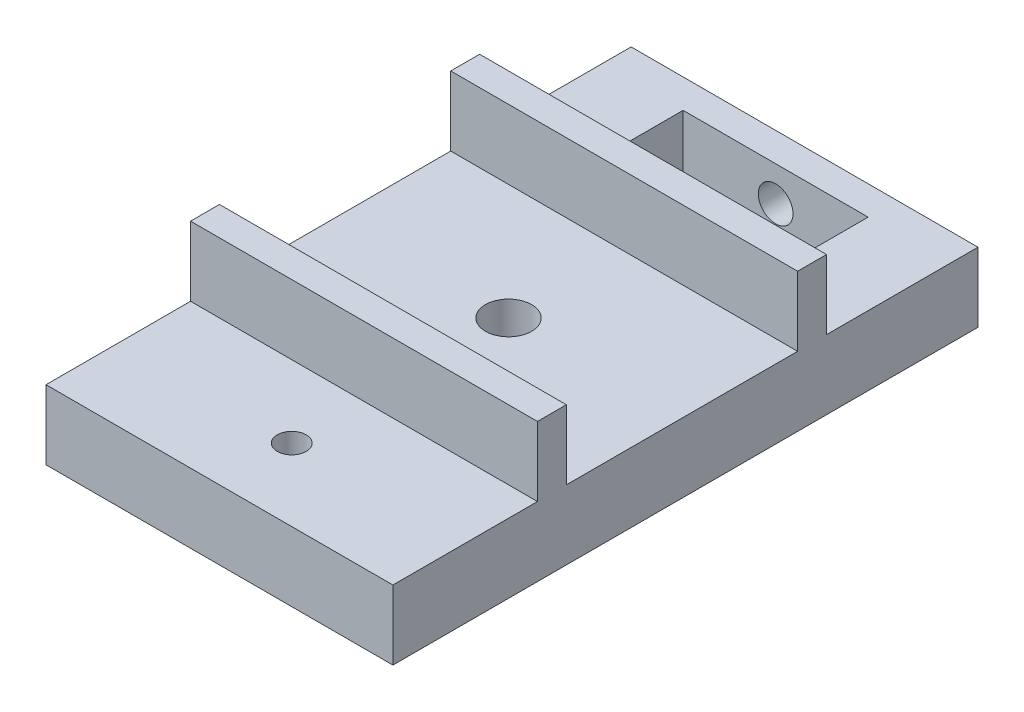
from build123d import *

# Parameters (mm, degrees)
SKETCH1_W           = 30
SKETCH1_H           = 38.1
SKETCH1_W_2         = 16
SKETCH1_H_2         = 10.6
BOSS_EXTRUDE1_DEPTH = 6
SKETCH1_3_W         = 30
SKETCH1_3_H         = 2.5
BOSS_EXTRUDE2_DEPTH = 12
SKETCH3_R           = 1.5
CUT_EXTRUDE2_DEPTH  = 5
CUT_EXTRUDE3_DEPTH  = 2.5
SKETCH2_R           = 2
CUT_EXTRUDE1_DEPTH  = 38.976966704
SKETCH5_W           = 30
SKETCH5_H           = 12.5
SKETCH5_R           = 1.25
BOSS_EXTRUDE3_DEPTH = 6


with BuildPart() as part:
    # Sketch1 → Boss-Extrude1 (new body)
    with BuildSketch(Plane(origin=(0, 0, 0), x_dir=(1, 0, 0), z_dir=(0, 1, 0))):
        with Locations((-15, -3.45)):
            Rectangle(SKETCH1_W, SKETCH1_H)
        with Locations((-15, 7.8)):
            Rectangle(SKETCH1_W_2, SKETCH1_H_2, mode=Mode.SUBTRACT)
    extrude(amount=BOSS_EXTRUDE1_DEPTH)

    # Sketch1<3> → Boss-Extrude2 (add)
    with BuildSketch(Plane(origin=(0, 0, 0), x_dir=(1, 0, 0), z_dir=(0, 1, 0))):
        with Locations((-15, -21.25)):
            Rectangle(SKETCH1_3_W, SKETCH1_3_H)
        with Locations((-15, 1.25)):
            Rectangle(SKETCH1_3_W, SKETCH1_3_H)
    extrude(amount=BOSS_EXTRUDE2_DEPTH)

    # Sketch3 → Cut-Extrude2 (cut)
    with BuildSketch(Plane(origin=(0, 0, -15.6), x_dir=(-1, 0, 0), z_dir=(0, 0, -1))):
        with Locations((15, 3)):
            Circle(SKETCH3_R)
    extrude(amount=-CUT_EXTRUDE2_DEPTH, mode=Mode.SUBTRACT)

    # Sketch4 → Cut-Extrude3 (cut)
    with BuildSketch(Plane(origin=(0, 0, -2.5), x_dir=(-1, 0, 0), z_dir=(0, 0, -1))):
        Polygon((16.443375673, 0.5), (17.886751346, 3), (16.443375673, 5.5), (13.556624327, 5.5), (12.113248654, 3), (13.556624327, 0.5), align=None)
    extrude(amount=-CUT_EXTRUDE3_DEPTH, mode=Mode.SUBTRACT)

    # Sketch2 → Cut-Extrude1 (cut, through all)
    with BuildSketch(Plane(origin=(0, 6, 0), x_dir=(1, 0, 0), z_dir=(0, 1, 0))):
        with Locations((-15, -10)):
            Circle(SKETCH2_R)
    extrude(amount=-CUT_EXTRUDE1_DEPTH, mode=Mode.SUBTRACT)

    # Sketch5 → Boss-Extrude3 (add)
    with BuildSketch(Plane.XZ):
        with Locations((-15, 28.75)):
            Rectangle(SKETCH5_W, SKETCH5_H)
        with Locations((-15, 28.75)):
            Circle(SKETCH5_R, mode=Mode.SUBTRACT)
    extrude(amount=-BOSS_EXTRUDE3_DEPTH)


solid = part.part
